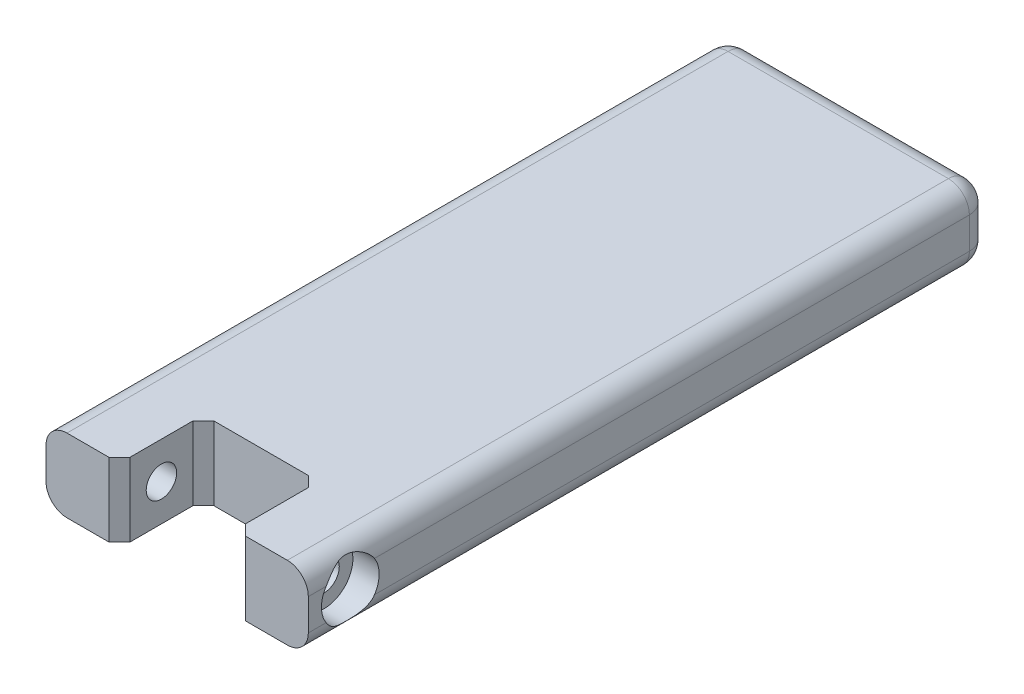
from build123d import *

# Parameters (mm, degrees)
SKETCH1_W                        = 25
SKETCH1_H                        = 7
BOSS_EXTRUDE1_DEPTH              = 65
SKETCH2_W                        = 11
SKETCH2_H                        = 8
CUT_EXTRUDE1_DEPTH               = 67.560123197
CHAMFER1_SIZE                    = 1
CBORE_FOR_M2_5_SHCS2_D           = 2.9
CBORE_FOR_M2_5_SHCS2_CBORE_D     = 5.5
CBORE_FOR_M2_5_SHCS2_CBORE_DEPTH = 2.5
FILLET1_R                        = 2
FILLET2_R                        = 2
CHAMFER2_SIZE                    = 1


with BuildPart() as part:
    # Sketch1 → Boss-Extrude1 (new body)
    with BuildSketch(Plane.XY):
        Rectangle(SKETCH1_W, SKETCH1_H)
    extrude(amount=BOSS_EXTRUDE1_DEPTH)

    # Sketch2 → Cut-Extrude1 (cut, through all)
    with BuildSketch(Plane(origin=(0, 3.5, 0), x_dir=(1, 0, 0), z_dir=(0, 1, 0))):
        with Locations((0, -61)):
            Rectangle(SKETCH2_W, SKETCH2_H)
    extrude(amount=-CUT_EXTRUDE1_DEPTH, mode=Mode.SUBTRACT)

    # Chamfer1
    chamfer1_edges = [part.edges().sort_by_distance(p)[0] for p in [
        (-5.5, 0, 57),
        (5.5, 0, 57),
    ]]
    chamfer(chamfer1_edges, length=CHAMFER1_SIZE)

    # CBORE for M2.5 SHCS2 (through all)
    with Locations(Plane(origin=(12.5, -6.575007997, 116.706532938), x_dir=(0, 0, -1), z_dir=(1, 0, 0))):
        with Locations((55.706532938, 6.575007997)):
            CounterBoreHole(CBORE_FOR_M2_5_SHCS2_D / 2, CBORE_FOR_M2_5_SHCS2_CBORE_D / 2, CBORE_FOR_M2_5_SHCS2_CBORE_DEPTH)

    # Fillet1
    # the kernel refuses this fillet: 2 mm, written as the material it takes off along each edge
    with BuildSketch(Plane(origin=(12.5, -3.5, -5), x_dir=(-1, 0, 0), z_dir=(0, 0, 1)), Plane(origin=(12.5, 3.5, -5), x_dir=(0, -1, 0), z_dir=(0, 0, 1))) as fillet1_piece_1:
        with BuildLine():
            CenterArc((FILLET1_R, -FILLET1_R), FILLET1_R, 90, 90)
            Line((0, -FILLET1_R), (0, 0))
            Line((0, 0), (FILLET1_R, 0))
        make_face()
    extrude(amount=75, mode=Mode.SUBTRACT)
    with BuildSketch(Plane(origin=(-12.5, -3.5, -5), x_dir=(1, 0, 0), z_dir=(0, 0, 1)), Plane(origin=(-12.5, 3.5, -5), x_dir=(0, -1, 0), z_dir=(0, 0, 1))) as fillet1_piece_2:
        with BuildLine():
            CenterArc((FILLET1_R, FILLET1_R), FILLET1_R, 180, 90)
            Line((0, FILLET1_R), (0, 0))
            Line((0, 0), (FILLET1_R, 0))
        make_face()
    extrude(amount=75, mode=Mode.SUBTRACT)

    # Fillet2
    fillet2_edges = [part.edges().sort_by_distance(p)[0] for p in [
        (-12.5, 0, 0),
        (12.5, 0, 0),
        (0, -3.5, 0),
        (0, 3.5, 0),
        (11.914213562, -2.914213562, 0),
        (-11.914213562, -2.914213562, 0),
        (11.914213562, 2.914213562, 0),
        (-11.914213562, 2.914213562, 0),
    ]]
    fillet(fillet2_edges, radius=FILLET2_R)

    # Chamfer2
    chamfer2_edges = [part.edges().sort_by_distance(p)[0] for p in [
        (-5.5, 0, 65),
        (5.5, 0, 65),
    ]]
    chamfer(chamfer2_edges, length=CHAMFER2_SIZE)


solid = part.part
